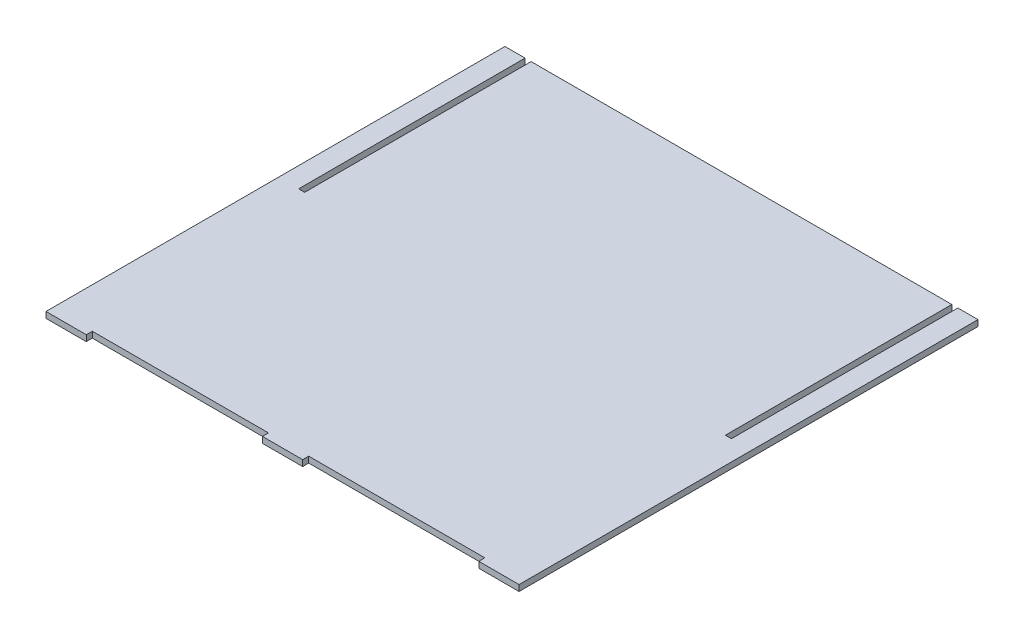
from build123d import *

# Parameters (mm, degrees)
BOSS_EXTRUDE1_DEPTH = 6
SKETCH2_W           = 6
SKETCH2_H           = 225
CUT_EXTRUDE1_DEPTH  = 6
LPATTERN1_COUNT     = 2
LPATTERN1_PITCH     = 424


with BuildPart() as part:
    # Sketch1 → Boss-Extrude1 (new body)
    with BuildSketch(Plane(origin=(0, 0, 0), x_dir=(1, 0, 0), z_dir=(0, 1, 0))):
        Polygon((-470, 0), (-430, 0), (-430, 6), (-255, 6), (-255, 0), (-215, 0), (-215, 6), (-40, 6), (-40, 0), (0, 0), (0, 456), (-470, 456), align=None)
    extrude(amount=BOSS_EXTRUDE1_DEPTH)

    # Sketch2 → Cut-Extrude1 (cut)
    with BuildSketch(Plane(origin=(0, 6, 0), x_dir=(1, 0, 0), z_dir=(0, 1, 0))):
        with Locations((-23, 343.5)):
            Rectangle(SKETCH2_W, SKETCH2_H)
    cut_extrude1 = extrude(amount=-CUT_EXTRUDE1_DEPTH, mode=Mode.SUBTRACT)

    # LPattern1: Cut-Extrude1 ×2
    with Locations(*[(-i * LPATTERN1_PITCH, 0, 0) for i in range(1, LPATTERN1_COUNT)]):
        add(cut_extrude1, mode=Mode.SUBTRACT)


solid = part.part
